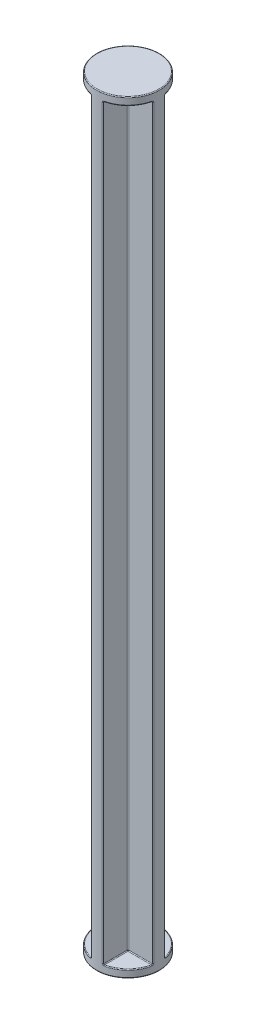
from build123d import *

# Parameters (mm, degrees)
SKETCH1_R           = 4
BOSS_EXTRUDE1_DEPTH = 97
CUT_EXTRUDE1_START  = -96
CUT_EXTRUDE1_DEPTH  = 95
FILLET1_R           = 0.1


with BuildPart() as part:
    # Sketch1 → Boss-Extrude1 (new body)
    with BuildSketch(Plane(origin=(0, 0, 0), x_dir=(1, 0, 0), z_dir=(0, 1, 0))):
        Circle(SKETCH1_R)
    extrude(amount=BOSS_EXTRUDE1_DEPTH)

    # Sketch2 → Cut-Extrude1 (cut)
    with BuildSketch(Plane(origin=(0, 97, 0), x_dir=(1, 0, 0), z_dir=(0, 1, 0)).offset(CUT_EXTRUDE1_START)):
        with BuildLine():
            Line((-0.75, 0.75), (-0.75, 3.929058411))
            ThreePointArc((-0.75, 3.929058411), (-2.828427125, 2.828427125), (-3.929058411, 0.75))
            Line((-3.929058411, 0.75), (-0.75, 0.75))
        make_face()
        with BuildLine():
            Line((-0.75, -0.75), (-3.929058411, -0.75))
            ThreePointArc((-3.929058411, -0.75), (-2.828427125, -2.828427125), (-0.75, -3.929058411))
            Line((-0.75, -3.929058411), (-0.75, -0.75))
        make_face()
        with BuildLine():
            Line((0.75, 0.75), (0.75, 3.929058411))
            ThreePointArc((0.75, 3.929058411), (2.828427125, 2.828427125), (3.929058411, 0.75))
            Line((3.929058411, 0.75), (0.75, 0.75))
        make_face()
        with BuildLine():
            Line((0.75, -0.75), (3.929058411, -0.75))
            ThreePointArc((3.929058411, -0.75), (2.828427125, -2.828427125), (0.75, -3.929058411))
            Line((0.75, -3.929058411), (0.75, -0.75))
        make_face()
    extrude(amount=CUT_EXTRUDE1_DEPTH, mode=Mode.SUBTRACT)

    # Fillet1
    fillet1_edges = [part.edges().sort_by_distance(p)[0] for p in [
        (-2.828427125, 96, 2.828427125),
        (-2.828427125, 96, -2.828427125),
        (2.828427125, 96, -2.828427125),
        (-0.75, 48.5, 3.929058411),
        (-0.75, 96, 2.339529206),
        (-0.75, 48.5, 0.75),
        (-3.929058411, 48.5, 0.75),
        (-2.339529206, 96, 0.75),
        (-2.828427125, 1, 2.828427125),
        (-2.339529206, 1, 0.75),
        (-0.75, 1, 2.339529206),
        (0.75, 1, 2.339529206),
        (0.75, 96, 2.339529206),
        (2.339529206, 1, 0.75),
        (0.75, 48.5, 0.75),
        (2.339529206, 96, 0.75),
        (-4, 0, 0),
        (3.929058411, 48.5, 0.75),
        (2.828427125, 96, 2.828427125),
        (0.75, 48.5, 3.929058411),
        (2.828427125, 1, 2.828427125),
        (-3.929058411, 48.5, -0.75),
        (-2.339529206, 96, -0.75),
        (-0.75, 48.5, -0.75),
        (-0.75, 48.5, -3.929058411),
        (-0.75, 96, -2.339529206),
        (-2.828427125, 1, -2.828427125),
        (-0.75, 1, -2.339529206),
        (-2.339529206, 1, -0.75),
        (3.929058411, 48.5, -0.75),
        (2.339529206, 96, -0.75),
        (0.75, 48.5, -3.929058411),
        (0.75, 48.5, -0.75),
        (0.75, 96, -2.339529206),
        (0.75, 1, -2.339529206),
        (2.828427125, 1, -2.828427125),
        (2.339529206, 1, -0.75),
        (-4, 97, 0),
    ]]
    fillet(fillet1_edges, radius=FILLET1_R)


solid = part.part
